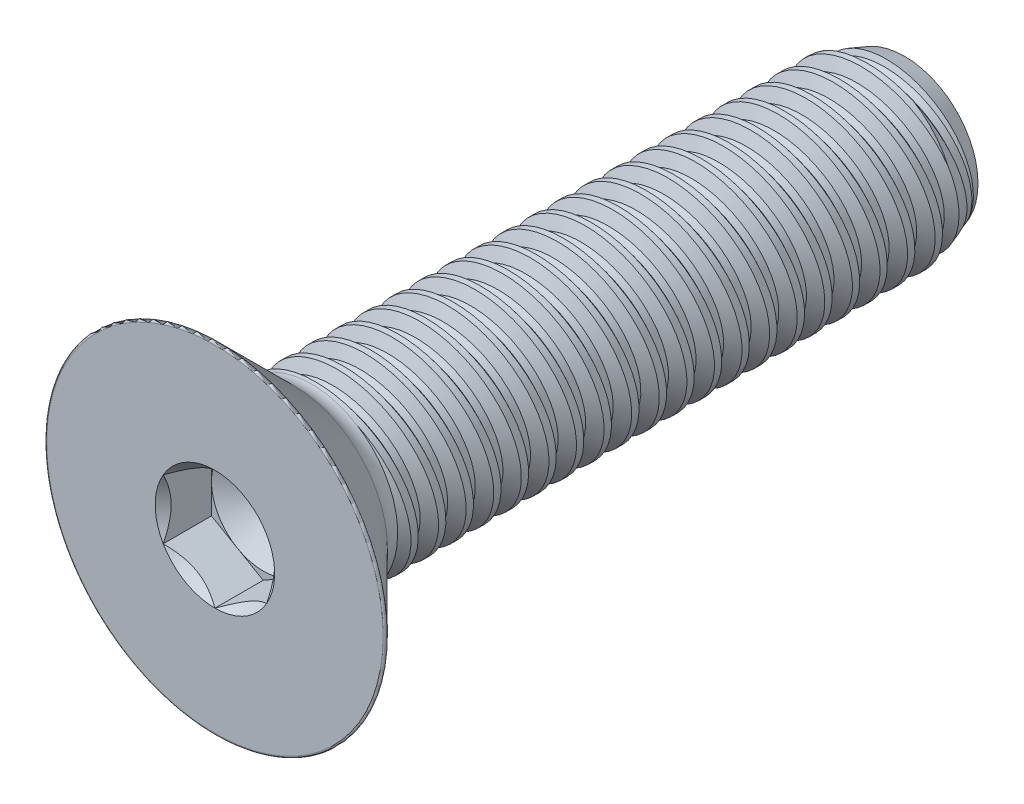
from build123d import *

# Parameters (mm, degrees)
SKETCH1_W          = 17.2
SKETCH1_H          = 2.5
LPATTERN1_COUNT    = 22
LPATTERN1_PITCH    = 0.8
LPATTERN2_COUNT    = 2
LPATTERN2_PITCH    = 0.8
SKETCH4_R          = 5
EXTRUDE1_DEPTH     = 2.8
FILLET1_R          = 0.0508
CUT_EXTRUDE1_DEPTH = 1.4
SKETCH7_R          = 1.732050808
CUT_EXTRUDE4_DEPTH = 1.4
CUT_EXTRUDE4_DRAFT = -45
SKETCH8_R          = 1.5
CUT_EXTRUDE5_DEPTH = 0.466666667
CUT_EXTRUDE5_DRAFT = -60


with BuildPart() as part:
    # Sketch1 → Revolve1 (revolve)
    with BuildSketch(Plane(origin=(0, 0, 0), x_dir=(0, 0, -1), z_dir=(1, 0, 0)), mode=Mode.PRIVATE) as revolve1_sk:
        with Locations((8.6, 1.25)):
            Rectangle(SKETCH1_W, SKETCH1_H)
    revolve(revolve1_sk.sketch.rotate(Axis((0, 0, 0), (0, 0, 1)), 143.569663536), axis=Axis((0, 0, 0), (0, 0, 1)))

    # Sketch2 → Cut-Revolve1 (revolve, cut)
    with BuildSketch(Plane(origin=(0, 0, 0), x_dir=(0, 0, -1), z_dir=(1, 0, 0)), mode=Mode.PRIVATE) as cut_revolve1_sk:
        Polygon((0.098744063, 2.51579905), (0.789952506, 2.626392401), (0.611504241, 2.15932044), (0.414016115, 2.127722339), align=None)
    cut_revolve1 = revolve(cut_revolve1_sk.sketch.rotate(Axis((0, -0.136915776, 0), (0, 0.1579905011066731, -0.9874406319167053)), 180), axis=Axis((0, -0.136915776, 0), (0, 0.1579905011066731, -0.9874406319167053)), mode=Mode.SUBTRACT)

    # Sketch3 → Cut-Revolve2 (revolve, cut)
    with BuildSketch(Plane(origin=(0, 0, 0), x_dir=(0, 0, -1), z_dir=(1, 0, 0)), mode=Mode.PRIVATE) as cut_revolve2_sk:
        Polygon((17.2, 2.127722339), (16.177175534, 2.5), (17.2, 2.5), align=None)
    revolve(cut_revolve2_sk.sketch.rotate(Axis((0, 0, -16.177175534), (0, 0, 1)), 143.569663536), axis=Axis((0, 0, -16.177175534), (0, 0, 1)), mode=Mode.SUBTRACT)

    # LPattern1: Cut-Revolve1 ×22
    with Locations(*[(0, 0, -i * LPATTERN1_PITCH) for i in range(1, LPATTERN1_COUNT)]):
        add(cut_revolve1, mode=Mode.SUBTRACT)

    # LPattern2: Cut-Revolve1 ×2
    with Locations(*[(0, 0, i * LPATTERN2_PITCH) for i in range(1, LPATTERN2_COUNT)]):
        add(cut_revolve1, mode=Mode.SUBTRACT)

    # Sketch4 → Extrude1 (add)
    with BuildSketch(Plane.XY):
        Circle(SKETCH4_R)
    extrude(amount=EXTRUDE1_DEPTH)

    # Sketch9 → Cut-Revolve3 (revolve, cut)
    with BuildSketch(Plane(origin=(0, 0, 0), x_dir=(0, 0, -1), z_dir=(1, 0, 0)), mode=Mode.PRIVATE) as cut_revolve3_sk:
        Polygon((-2.8, 5), (0, 2.2), (0, 5), align=None)
    revolve(cut_revolve3_sk.sketch.rotate(Axis((0, 0, 0), (0, 0, 1)), 180), axis=Axis((0, 0, 0), (0, 0, 1)), mode=Mode.SUBTRACT)

    # Fillet1
    fillet1_edges = [part.edges().sort_by_distance(p)[0] for p in [
        (0, 5, 2.8),
    ]]
    fillet(fillet1_edges, radius=FILLET1_R)

    # Sketch6 → Cut-Extrude1 (cut)
    with BuildSketch(Plane.XY.offset(2.8)):
        Polygon((0, -1.732050808), (1.5, -0.866025404), (1.5, 0.866025404), (0, 1.732050808), (-1.5, 0.866025404), (-1.5, -0.866025404), align=None)
    extrude(amount=-CUT_EXTRUDE1_DEPTH, mode=Mode.SUBTRACT)


with BuildPart() as cut_extrude4_tool:
    # Sketch7 → Cut-Extrude4 (with draft: the straight prism first)
    with BuildSketch(Plane.XY.offset(2.8)):
        Circle(SKETCH7_R)
    extrude(amount=-CUT_EXTRUDE4_DEPTH)
    # Cut-Extrude4: the draft: its side faces are tilted about the plane it starts from
    cut_extrude4_sides = [cut_extrude4_tool.faces().sort_by_distance(p)[0] for p in [
        (-1.732050808, 0, 2.1),
    ]]
    draft(cut_extrude4_sides, Plane.XY.offset(2.8), CUT_EXTRUDE4_DRAFT)


with BuildPart() as part_1:
    add(part.part)

    # Cut-Extrude4: cut by cut_extrude4_tool
    add(cut_extrude4_tool.part, mode=Mode.SUBTRACT)


with BuildPart() as cut_extrude5_tool:
    # Sketch8 → Cut-Extrude5 (with draft: the straight prism first)
    with BuildSketch(Plane.XY.offset(1.4)):
        Circle(SKETCH8_R)
    extrude(amount=-CUT_EXTRUDE5_DEPTH)
    # Cut-Extrude5: the draft: its side faces are tilted about the plane it starts from
    cut_extrude5_sides = [cut_extrude5_tool.faces().sort_by_distance(p)[0] for p in [
        (-1.5, 0, 1.166666667),
    ]]
    draft(cut_extrude5_sides, Plane.XY.offset(1.4), CUT_EXTRUDE5_DRAFT)


with BuildPart() as part_2:
    add(part_1.part)

    # Cut-Extrude5: cut by cut_extrude5_tool
    add(cut_extrude5_tool.part, mode=Mode.SUBTRACT)

    # Sketch12 → Revolve2 (revolve)
    with BuildSketch(Plane(origin=(0, 0, 0), x_dir=(0, 0, -1), z_dir=(1, 0, 0)), mode=Mode.PRIVATE) as revolve2_sk:
        with BuildLine():
            Line((0, 2.5), (0, 2.2))
            Line((0, 2.2), (-0.512132034, 2.712132034))
            ThreePointArc((-0.512132034, 2.712132034), (-0.27716386, 2.555131319), (0, 2.5))
        make_face()
    revolve(revolve2_sk.sketch.rotate(Axis((0, 0, 0), (0, 0, 1)), 180), axis=Axis((0, 0, 0), (0, 0, 1)))


solid = part_2.part
